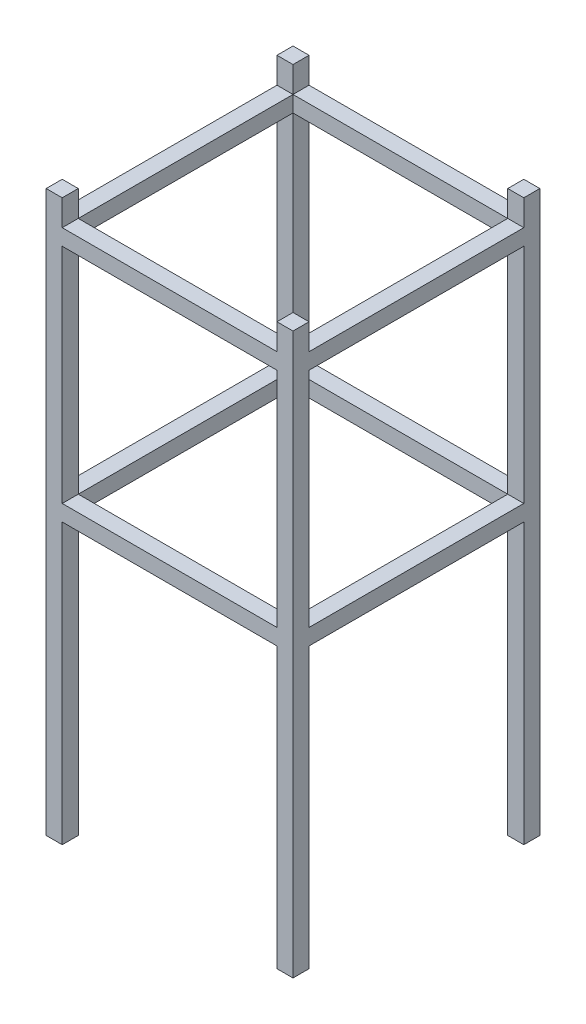
from build123d import *

# Parameters (mm, degrees)
SKETCH3_W                = 6.5
SKETCH3_H                = 6.5
BOSS_EXTRUDE1_DEPTH      = 200
BOSS_EXTRUDE1_2_DEPTH    = 200
BOSS_EXTRUDE1_3_DEPTH    = 200
BOSS_EXTRUDE1_4_DEPTH    = 200
SKETCH11_W               = 100
SKETCH11_H               = 100
SKETCH11_W_2             = 87
SKETCH11_H_2             = 87
BOSS_EXTRUDE7_DEPTH      = 6.5
BOSS_EXTRUDE8_DEPTH      = 3.25
BOSS_EXTRUDE8_DEPTH_BACK = 3.25
BOSS_EXTRUDE8_START      = -100
SKETCH12_W               = 100
SKETCH12_H               = 100
SKETCH12_W_2             = 87
SKETCH12_H_2             = 87
SKETCH13_W               = 6.5
SKETCH13_H               = 6.5
BOSS_EXTRUDE9_DEPTH      = 10.5
SKETCH14_W               = 6.5
SKETCH14_H               = 6.5
BOSS_EXTRUDE10_DEPTH     = 16.5


with BuildPart() as part:
    # Sketch3 → Boss-Extrude1 (new body)
    with BuildSketch(Plane(origin=(0, 0, 0), x_dir=(1, 0, 0), z_dir=(0, 1, 0))):
        with Locations((-46.75, 46.75)):
            Rectangle(SKETCH3_W, SKETCH3_H)
    extrude(amount=BOSS_EXTRUDE1_DEPTH)



with BuildPart() as body_2:
    # Sketch3 → Boss-Extrude1 2 (new body)
    with BuildSketch(Plane(origin=(0, 0, 0), x_dir=(1, 0, 0), z_dir=(0, 1, 0))):
        with Locations((46.75, 46.75)):
            Rectangle(SKETCH3_W, SKETCH3_H)
    extrude(amount=BOSS_EXTRUDE1_2_DEPTH)


with BuildPart() as body_3:
    # Sketch3 → Boss-Extrude1 3 (new body)
    with BuildSketch(Plane(origin=(0, 0, 0), x_dir=(1, 0, 0), z_dir=(0, 1, 0))):
        with Locations((46.75, -46.75)):
            Rectangle(SKETCH3_W, SKETCH3_H)
    extrude(amount=BOSS_EXTRUDE1_3_DEPTH)


with BuildPart() as body_4:
    # Sketch3 → Boss-Extrude1 4 (new body)
    with BuildSketch(Plane(origin=(0, 0, 0), x_dir=(1, 0, 0), z_dir=(0, 1, 0))):
        with Locations((-46.75, -46.75)):
            Rectangle(SKETCH3_W, SKETCH3_H)
    extrude(amount=BOSS_EXTRUDE1_4_DEPTH)


with BuildPart() as part_1:
    add(part.part)

    add(body_2.part)  # Boss-Extrude7 merges body 2

    add(body_3.part)  # Boss-Extrude7 merges body 3

    add(body_4.part)  # Boss-Extrude7 merges body 4
    # Sketch11 → Boss-Extrude7 (add)
    with BuildSketch(Plane(origin=(0, 200, 0), x_dir=(1, 0, 0), z_dir=(0, 1, 0))):
        Rectangle(SKETCH11_W, SKETCH11_H)
        Rectangle(SKETCH11_W_2, SKETCH11_H_2, mode=Mode.SUBTRACT)
    extrude(amount=-BOSS_EXTRUDE7_DEPTH)

    # Sketch12 → Boss-Extrude8 (add, two sides: drawn at the far end of the back side and taken through both)
    with BuildSketch(Plane(origin=(0, 200, 0), x_dir=(1, 0, 0), z_dir=(0, 1, 0)).offset(BOSS_EXTRUDE8_START - BOSS_EXTRUDE8_DEPTH_BACK)):
        Rectangle(SKETCH12_W, SKETCH12_H)
        Rectangle(SKETCH12_W_2, SKETCH12_H_2, mode=Mode.SUBTRACT)
    extrude(amount=BOSS_EXTRUDE8_DEPTH + BOSS_EXTRUDE8_DEPTH_BACK)

    # Sketch13 → Boss-Extrude9 (add)
    with BuildSketch(Plane(origin=(0, 200, 0), x_dir=(1, 0, 0), z_dir=(0, 1, 0))):
        with Locations((-46.75, 46.75)):
            Rectangle(SKETCH13_W, SKETCH13_H)
        with Locations((46.75, 46.75)):
            Rectangle(SKETCH13_W, SKETCH13_H)
        with Locations((46.75, -46.75)):
            Rectangle(SKETCH13_W, SKETCH13_H)
        with Locations((-46.75, -46.75)):
            Rectangle(SKETCH13_W, SKETCH13_H)
    extrude(amount=BOSS_EXTRUDE9_DEPTH)

    # Sketch14 → Boss-Extrude10 (add)
    with BuildSketch(Plane.XZ):
        with Locations((-46.75, 46.75)):
            Rectangle(SKETCH14_W, SKETCH14_H)
        with Locations((46.75, 46.75)):
            Rectangle(SKETCH14_W, SKETCH14_H)
        with Locations((46.75, -46.75)):
            Rectangle(SKETCH14_W, SKETCH14_H)
        with Locations((-46.75, -46.75)):
            Rectangle(SKETCH14_W, SKETCH14_H)
    extrude(amount=BOSS_EXTRUDE10_DEPTH)


solid = part_1.part
